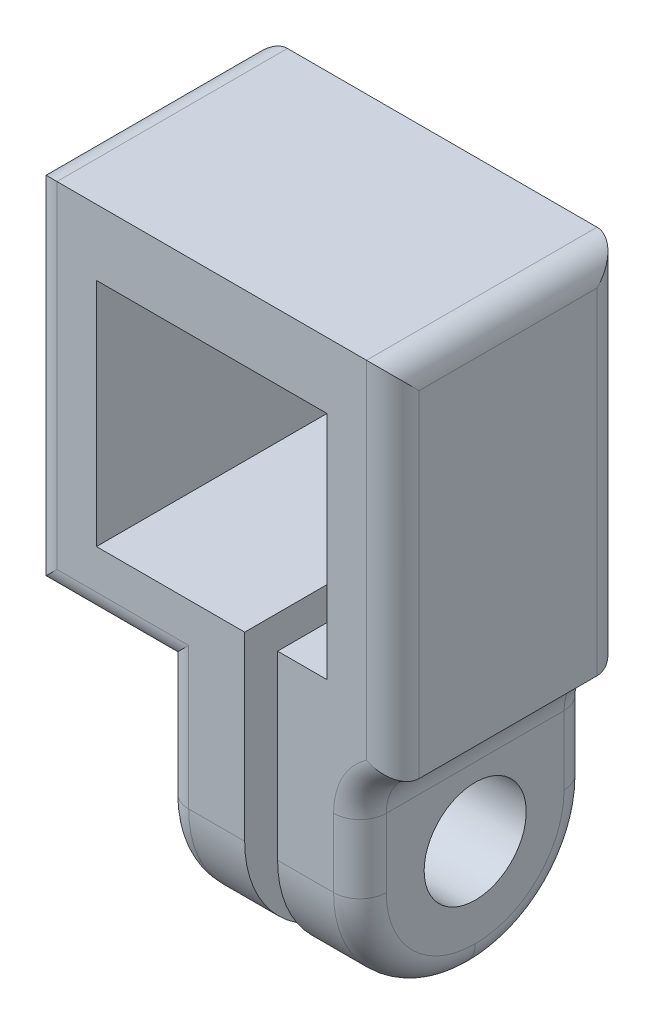
from build123d import *

# Parameters (mm, degrees)
EXTRUDE_1_DEPTH     = 7
FILLET_1_R          = 3.5
SKETCH_2_R          = 1.55
CUT_EXTRUDE_1_DEPTH = 16.173990905
FILLET_2_R          = 1.5
FILLET_3_R          = 0.8


# Some blends are built 0.0001 mm under size
with BuildPart() as part:
    # 草图1 → 凸台-拉伸1 (new body)
    with BuildSketch(Plane.XY):
        Polygon((2, -2.5), (2.5, -2.5), (3.5, -2.5), (3.5, 4.5), (-3.5, 4.5), (-3.5, -2.5), (-2.5, -2.5), (1, -2.5), (1, -11.5), (0.5, -11.5), (-1.5, -11.5), (-1.5, -4.5), (-4.5, -4.5), (-5.5, -4.5), (-5.5, 6.5), (5.5, 6.5), (5.5, -4.5), (4.5, -4.5), (4.5, -11.5), (2.5, -11.5), (2, -11.5), align=None)
    extrude(amount=-EXTRUDE_1_DEPTH)

    # 圆角1
    fillet_1_edges = [part.edges().sort_by_distance(p)[0] for p in [
        (3.25, -11.5, 0),
        (3.25, -11.5, -7),
        (-0.25, -11.5, -7),
        (-0.25, -11.5, 0),
    ]]
    fillet(fillet_1_edges, radius=FILLET_1_R - 0.0001)  # a hair under: the kernel refuses the full size

    # 草图2 → 切除-拉伸1 (cut, through all)
    with BuildSketch(Plane.ZY.offset(1.5)):
        with Locations((-3.5, -8)):
            Circle(SKETCH_2_R)
    extrude(amount=-CUT_EXTRUDE_1_DEPTH, mode=Mode.SUBTRACT)

    # 圆角2
    # the kernel refuses this fillet: 1.5 mm, written as the material it adds along each edge
    with BuildSketch(Plane(origin=(4.5, -4.5, 0), x_dir=(1, 0, 0), z_dir=(0, 0, -1))) as fillet_2_piece_1:
        with BuildLine():
            CenterArc((1.5, 1.414213562), FILLET_2_R, 180, 70.528779366)
            Line((0, 1.414213562), (-0.03, 1.414213562))
            Line((-0.03, 1.414213562), (-0.03, 0))
            Line((-0.03, 0), (0, -0.03))
            ThreePointArc((0, -0.03), (0.5, -0.03), (0.99, -0.028284271))
            Line((0.99, -0.028284271), (1, 0))
        make_face()
    extrude(amount=7)

    # 圆角3
    fillet_3_edges = [part.edges().sort_by_distance(p)[0] for p in [
        (-1.5, -6.25005, 0),
        (-3.5, -4.5, 0),
        (-5.5, 1, 0),
        (5.5, 1, 0),
        (5.5, 1, -7),
        (-5.5, 1, -7),
        (-3.5, -4.5, -7),
        (-5.5, 6.5, -3.5),
        (5.5, 6.5, -3.5),
        (-1.5, -6.25005, -7),
        (4.5, -6.957156781, 0),
        (4.5, -6.957156781, -7),
        (4.5, -10.474903023, -5.974903023),
        (4.5, -10.474903023, -1.025096977),
        (-1.5, -10.474903023, -1.025096977),
        (-1.5, -10.474903023, -5.974903023),
        (4.775255129, -5.048188159, 0),
        (4.775255129, -5.048188159, -7),
    ]]
    fillet(fillet_3_edges, radius=FILLET_3_R)


solid = part.part
